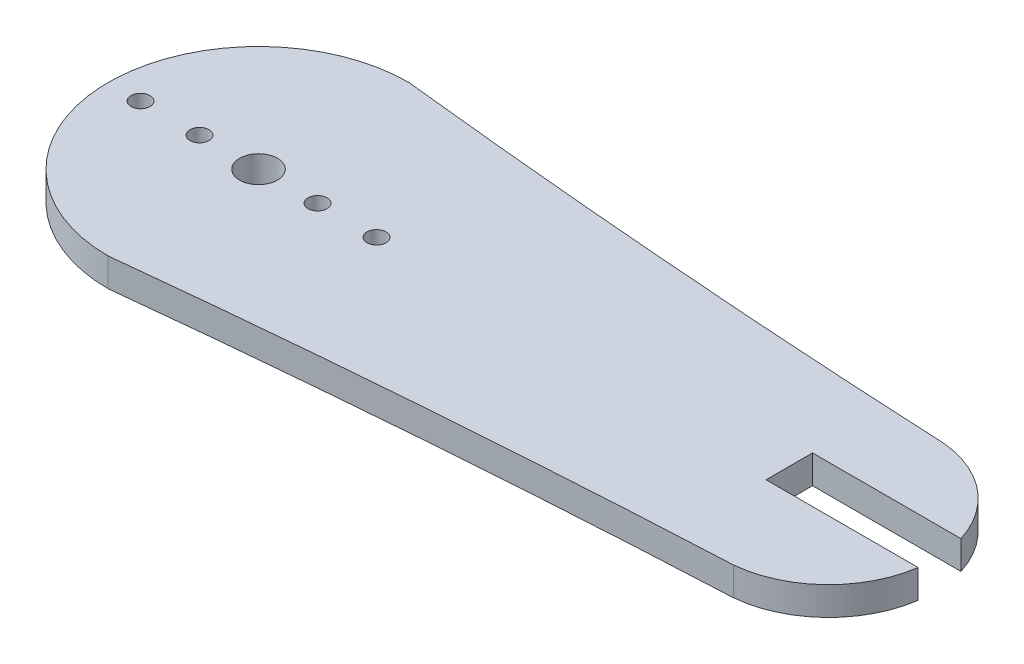
from build123d import *

# Parameters (mm, degrees)
SKETCH1_R           = 1
SKETCH1_R_2         = 2
BOSS_EXTRUDE1_DEPTH = 3


with BuildPart() as part:
    # Sketch1 → Boss-Extrude1 (new body)
    with BuildSketch(Plane(origin=(0, 0, 0), x_dir=(1, 0, 0), z_dir=(0, 1, 0))):
        with BuildLine():
            Line((64.176944727, -16.440444348), (48.133067619, -16.440444348))
            Line((48.133067619, -16.440444348), (48.133067619, -11.540444348))
            Line((48.133067619, -11.540444348), (63.793055105, -11.540444348))
            ThreePointArc((63.793055105, -11.540444348), (60.173162889, -6.183390259), (54.189826358, -3.733628612))
            ThreePointArc((54.189826358, -3.733628612), (53.662670154, -3.708804342), (53.135527124, -3.683701873))
            ThreePointArc((53.135527124, -3.683701873), (24.702146142, -1.915932839), (-3.669341235, 0.661054823))
            ThreePointArc((-3.669341235, 0.661054823), (-5.346030709, 0.838891836), (-7.022417949, 1.019555652))
            ThreePointArc((-7.022417949, 1.019555652), (-22.882417949, -14.840444348), (-7.022417949, -30.700444348))
            ThreePointArc((-7.022417949, -30.700444348), (-5.346030709, -30.519780533), (-3.669341235, -30.341943519))
            ThreePointArc((-3.669341235, -30.341943519), (24.702146142, -27.764955858), (53.135527124, -25.997186824))
            ThreePointArc((53.135527124, -25.997186824), (53.662670154, -25.972084355), (54.189826358, -25.947260084))
            ThreePointArc((54.189826358, -25.947260084), (60.827827028, -22.921374051), (64.176944727, -16.440444348))
        make_face()
        with Locations((-19.472417949, -14.840444348)):
            Circle(SKETCH1_R, mode=Mode.SUBTRACT)
        with Locations((-13.247417949, -14.840444348)):
            Circle(SKETCH1_R, mode=Mode.SUBTRACT)
        with Locations((-7.022417949, -14.840444348)):
            Circle(SKETCH1_R_2, mode=Mode.SUBTRACT)
        with Locations((-0.797417949, -14.840444348)):
            Circle(SKETCH1_R, mode=Mode.SUBTRACT)
        with Locations((5.427582051, -14.840444348)):
            Circle(SKETCH1_R, mode=Mode.SUBTRACT)
    extrude(amount=BOSS_EXTRUDE1_DEPTH)


solid = part.part
